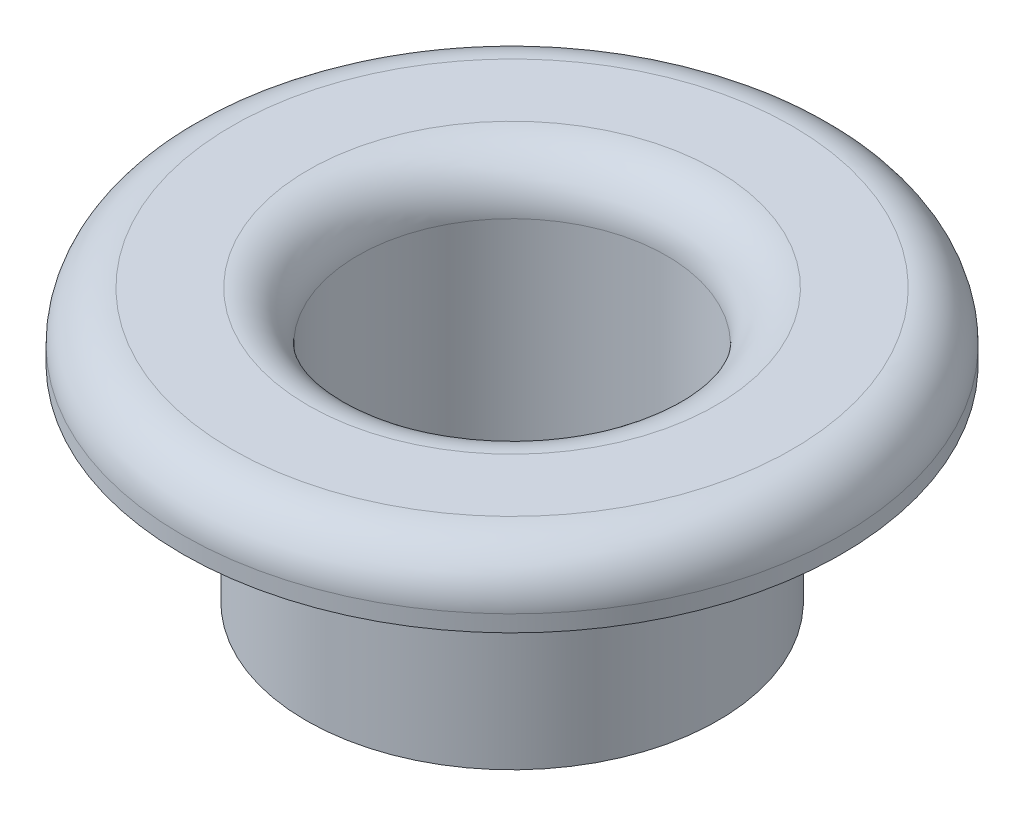
from build123d import *

# Parameters (mm, degrees)
SKETCH1_R           = 3.175
SKETCH1_R_2         = 2.38125
BOSS_EXTRUDE1_DEPTH = 3.175
SKETCH2_R           = 5.08
SKETCH2_R_2         = 2.38125
BOSS_EXTRUDE2_DEPTH = 1.016
FILLET1_R           = 0.762


with BuildPart() as part:
    # Sketch1 → Boss-Extrude1 (new body)
    with BuildSketch(Plane(origin=(0, 0, 0), x_dir=(1, 0, 0), z_dir=(0, 1, 0))):
        Circle(SKETCH1_R)
        Circle(SKETCH1_R_2, mode=Mode.SUBTRACT)
    extrude(amount=BOSS_EXTRUDE1_DEPTH)

    # Sketch2 → Boss-Extrude2 (add)
    with BuildSketch(Plane(origin=(0, 3.175, 0), x_dir=(1, 0, 0), z_dir=(0, 1, 0))):
        Circle(SKETCH2_R)
        Circle(SKETCH2_R_2, mode=Mode.SUBTRACT)
    extrude(amount=BOSS_EXTRUDE2_DEPTH)

    # Fillet1
    fillet1_edges = [part.edges().sort_by_distance(p)[0] for p in [
        (-5.08, 4.191, 0),
        (-2.38125, 4.191, 0),
    ]]
    fillet(fillet1_edges, radius=FILLET1_R)


solid = part.part
